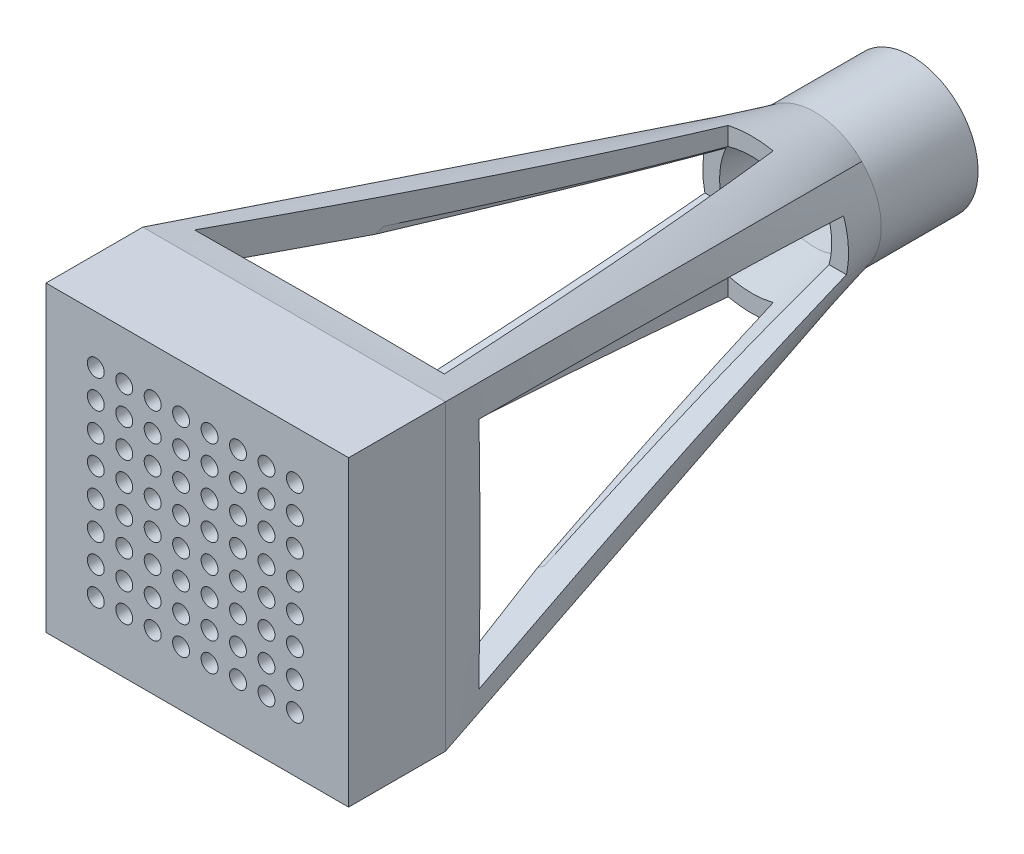
from build123d import *

# Parameters (mm, degrees)
SKETCH4_W           = 25
SKETCH4_H           = 25
BOSS_EXTRUDE1_DEPTH = 8
SKETCH5_R           = 0.7
CUT_EXTRUDE1_DEPTH  = 8
SKETCH6_R           = 5.5
SKETCH6_R_2         = 4.2
BOSS_EXTRUDE2_DEPTH = 8
CUT_EXTRUDE2_DEPTH  = 58
CUT_EXTRUDE3_DEPTH  = 58
CUT_EXTRUDE4_DEPTH  = 58
CUT_EXTRUDE5_DEPTH  = 58


with BuildPart() as part:
    # Loft1: read off the stored shape, not the designer's step
    # Loft1: loft between two sections, ruled curve by curve
    loft1_from = [
        Edge.make_bspline([(-12.5, 12.5, 43), (-10.416666667, 12.5, 43), (-8.333333333, 12.5, 43), (-5.208333333, 12.5, 43), (-4.166666667, 12.5, 43), (-2.083333333, 12.5, 43), (-1.041666667, 12.5, 43), (1.041666667, 12.5, 43), (2.083333333, 12.5, 43), (4.166666667, 12.5, 43), (5.208333333, 12.5, 43), (8.333333333, 12.5, 43), (10.416666667, 12.5, 43), (12.5, 12.5, 43)], [0, 0, 0, 0, 0.25, 0.25, 0.375, 0.375, 0.5, 0.5, 0.625, 0.625, 0.75, 0.75, 1, 1, 1, 1], 3),
        Edge.make_bspline([(12.5, 12.5, 43), (12.5, 10.416666667, 43), (12.5, 8.333333333, 43), (12.5, 5.208333333, 43), (12.5, 4.166666667, 43), (12.5, 2.083333333, 43), (12.5, 1.041666667, 43), (12.5, -1.041666667, 43), (12.5, -2.083333333, 43), (12.5, -4.166666667, 43), (12.5, -5.208333333, 43), (12.5, -8.333333333, 43), (12.5, -10.416666667, 43), (12.5, -12.5, 43)], [0, 0, 0, 0, 0.25, 0.25, 0.375, 0.375, 0.5, 0.5, 0.625, 0.625, 0.75, 0.75, 1, 1, 1, 1], 3),
        Edge.make_bspline([(-12.5, -12.5, 43), (-12.5, -10.416666667, 43), (-12.5, -8.333333333, 43), (-12.5, -5.208333333, 43), (-12.5, -4.166666667, 43), (-12.5, -2.083333333, 43), (-12.5, -1.041666667, 43), (-12.5, 1.041666667, 43), (-12.5, 2.083333333, 43), (-12.5, 4.166666667, 43), (-12.5, 5.208333333, 43), (-12.5, 8.333333333, 43), (-12.5, 10.416666667, 43), (-12.5, 12.5, 43)], [0, 0, 0, 0, 0.25, 0.25, 0.375, 0.375, 0.5, 0.5, 0.625, 0.625, 0.75, 0.75, 1, 1, 1, 1], 3),
        Edge.make_bspline([(12.5, -12.5, 43), (10.416666667, -12.5, 43), (8.333333333, -12.5, 43), (5.208333333, -12.5, 43), (4.166666667, -12.5, 43), (2.083333333, -12.5, 43), (1.041666667, -12.5, 43), (-1.041666667, -12.5, 43), (-2.083333333, -12.5, 43), (-4.166666667, -12.5, 43), (-5.208333333, -12.5, 43), (-8.333333333, -12.5, 43), (-10.416666667, -12.5, 43), (-12.5, -12.5, 43)], [0, 0, 0, 0, 0.25, 0.25, 0.375, 0.375, 0.5, 0.5, 0.625, 0.625, 0.75, 0.75, 1, 1, 1, 1], 3),
    ]
    loft1_to = [
        Edge.make_bspline([(-3.889087297, 3.889087297, 0), (-3.430753963, 4.34742063, 0), (-2.852736933, 4.758372279, 0), (-1.85034465, 5.192184354, 0), (-1.494698167, 5.306317307, 0), (-0.759306052, 5.460272914, 0), (-0.379695766, 5.5, 0), (0.379695766, 5.5, 0), (0.759306052, 5.460272914, 0), (1.494698167, 5.306317307, 0), (1.85034465, 5.192184354, 0), (2.852736933, 4.758372279, 0), (3.430753963, 4.34742063, 0), (3.889087297, 3.889087297, 0)], [0, 0, 0, 0, 0.25, 0.25, 0.375, 0.375, 0.5, 0.5, 0.625, 0.625, 0.75, 0.75, 1, 1, 1, 1], 3),
        Edge.make_bspline([(3.889087297, 3.889087297, 0), (4.34742063, 3.430753963, 0), (4.758372279, 2.852736933, 0), (5.192184354, 1.85034465, 0), (5.306317307, 1.494698167, 0), (5.460272914, 0.759306052, 0), (5.5, 0.379695766, 0), (5.5, -0.379695766, 0), (5.460272914, -0.759306052, 0), (5.306317307, -1.494698167, 0), (5.192184354, -1.85034465, 0), (4.758372279, -2.852736933, 0), (4.34742063, -3.430753963, 0), (3.889087297, -3.889087297, 0)], [0, 0, 0, 0, 0.25, 0.25, 0.375, 0.375, 0.5, 0.5, 0.625, 0.625, 0.75, 0.75, 1, 1, 1, 1], 3),
        Edge.make_bspline([(-3.889087297, -3.889087297, 0), (-4.34742063, -3.430753963, 0), (-4.758372279, -2.852736933, 0), (-5.192184354, -1.85034465, 0), (-5.306317307, -1.494698167, 0), (-5.460272914, -0.759306052, 0), (-5.5, -0.379695766, 0), (-5.5, 0.379695766, 0), (-5.460272914, 0.759306052, 0), (-5.306317307, 1.494698167, 0), (-5.192184354, 1.85034465, 0), (-4.758372279, 2.852736933, 0), (-4.34742063, 3.430753963, 0), (-3.889087297, 3.889087297, 0)], [0, 0, 0, 0, 0.25, 0.25, 0.375, 0.375, 0.5, 0.5, 0.625, 0.625, 0.75, 0.75, 1, 1, 1, 1], 3),
        Edge.make_bspline([(3.889087297, -3.889087297, 0), (3.430753963, -4.34742063, 0), (2.852736933, -4.758372279, 0), (1.85034465, -5.192184354, 0), (1.494698167, -5.306317307, 0), (0.759306052, -5.460272914, 0), (0.379695766, -5.5, 0), (-0.379695766, -5.5, 0), (-0.759306052, -5.460272914, 0), (-1.494698167, -5.306317307, 0), (-1.85034465, -5.192184354, 0), (-2.852736933, -4.758372279, 0), (-3.430753963, -4.34742063, 0), (-3.889087297, -3.889087297, 0)], [0, 0, 0, 0, 0.25, 0.25, 0.375, 0.375, 0.5, 0.5, 0.625, 0.625, 0.75, 0.75, 1, 1, 1, 1], 3),
    ]
    loft1 = Solid(Shell([*[Face.make_surface_from_curves(loft1_from[k], loft1_to[k]) for k in range(4)], Face(Wire(loft1_from)), Face(Wire(loft1_to))]))
    add(loft1)

    # Cut-Loft1: read off the stored shape, not the designer's step
    # Cut-Loft1: loft between two sections, ruled curve by curve
    cut_loft1_from = [
        Edge.make_bspline([(-2.969848481, -2.969848481, 0), (-2.619848481, -3.319848481, 0), (-2.178453658, -3.633666104, 0), (-1.157836061, -4.075365671, 0), (-0.579898987, -4.2, 0), (0.579898987, -4.2, 0), (1.157836061, -4.075365671, 0), (2.178453658, -3.633666104, 0), (2.619848481, -3.319848481, 0), (2.969848481, -2.969848481, 0)], [0, 0, 0, 0, 0.25, 0.25, 0.5, 0.5, 0.75, 0.75, 1, 1, 1, 1], 3),
        Edge.make_bspline([(2.969848481, -2.969848481, 0), (3.319848481, -2.619848481, 0), (3.633666104, -2.178453658, 0), (4.075365671, -1.157836061, 0), (4.2, -0.579898987, 0), (4.2, 0.579898987, 0), (4.075365671, 1.157836061, 0), (3.633666104, 2.178453658, 0), (3.319848481, 2.619848481, 0), (2.969848481, 2.969848481, 0)], [0, 0, 0, 0, 0.25, 0.25, 0.5, 0.5, 0.75, 0.75, 1, 1, 1, 1], 3),
        Edge.make_bspline([(-2.969848481, 2.969848481, 0), (-3.319848481, 2.619848481, 0), (-3.633666104, 2.178453658, 0), (-4.075365671, 1.157836061, 0), (-4.2, 0.579898987, 0), (-4.2, -0.579898987, 0), (-4.075365671, -1.157836061, 0), (-3.633666104, -2.178453658, 0), (-3.319848481, -2.619848481, 0), (-2.969848481, -2.969848481, 0)], [0, 0, 0, 0, 0.25, 0.25, 0.5, 0.5, 0.75, 0.75, 1, 1, 1, 1], 3),
        Edge.make_bspline([(2.969848481, 2.969848481, 0), (2.619848481, 3.319848481, 0), (2.178453658, 3.633666104, 0), (1.157836061, 4.075365671, 0), (0.579898987, 4.2, 0), (-0.579898987, 4.2, 0), (-1.157836061, 4.075365671, 0), (-2.178453658, 3.633666104, 0), (-2.619848481, 3.319848481, 0), (-2.969848481, 2.969848481, 0)], [0, 0, 0, 0, 0.25, 0.25, 0.5, 0.5, 0.75, 0.75, 1, 1, 1, 1], 3),
    ]
    cut_loft1_to = [
        Edge.make_bspline([(-10, -10, 43), (-8.333333333, -10, 43), (-6.666666667, -10, 43), (-3.333333333, -10, 43), (-1.666666667, -10, 43), (1.666666667, -10, 43), (3.333333333, -10, 43), (6.666666667, -10, 43), (8.333333333, -10, 43), (10, -10, 43)], [0, 0, 0, 0, 0.25, 0.25, 0.5, 0.5, 0.75, 0.75, 1, 1, 1, 1], 3),
        Edge.make_bspline([(10, -10, 43), (10, -8.333333333, 43), (10, -6.666666667, 43), (10, -3.333333333, 43), (10, -1.666666667, 43), (10, 1.666666667, 43), (10, 3.333333333, 43), (10, 6.666666667, 43), (10, 8.333333333, 43), (10, 10, 43)], [0, 0, 0, 0, 0.25, 0.25, 0.5, 0.5, 0.75, 0.75, 1, 1, 1, 1], 3),
        Edge.make_bspline([(-10, 10, 43), (-10, 8.333333333, 43), (-10, 6.666666667, 43), (-10, 3.333333333, 43), (-10, 1.666666667, 43), (-10, -1.666666667, 43), (-10, -3.333333333, 43), (-10, -6.666666667, 43), (-10, -8.333333333, 43), (-10, -10, 43)], [0, 0, 0, 0, 0.25, 0.25, 0.5, 0.5, 0.75, 0.75, 1, 1, 1, 1], 3),
        Edge.make_bspline([(10, 10, 43), (8.333333333, 10, 43), (6.666666667, 10, 43), (3.333333333, 10, 43), (1.666666667, 10, 43), (-1.666666667, 10, 43), (-3.333333333, 10, 43), (-6.666666667, 10, 43), (-8.333333333, 10, 43), (-10, 10, 43)], [0, 0, 0, 0, 0.25, 0.25, 0.5, 0.5, 0.75, 0.75, 1, 1, 1, 1], 3),
    ]
    cut_loft1 = Solid(Shell([*[Face.make_surface_from_curves(cut_loft1_from[k], cut_loft1_to[k]) for k in range(4)], Face(Wire(cut_loft1_from)), Face(Wire(cut_loft1_to))]))
    add(cut_loft1, mode=Mode.SUBTRACT)

    # Sketch4 → Boss-Extrude1 (add)
    with BuildSketch(Plane.XY.offset(43)):
        Rectangle(SKETCH4_W, SKETCH4_H)
    extrude(amount=BOSS_EXTRUDE1_DEPTH)

    # Sketch5 → Cut-Extrude1 (cut)
    with BuildSketch(Plane.XY.offset(43)):
        with Locations((-8.388056057, 8.509622087)):
            Circle(SKETCH5_R)
        with Locations((-6.038056057, 8.509622087)):
            Circle(SKETCH5_R)
        with Locations((-3.688056057, 8.509622087)):
            Circle(SKETCH5_R)
        with Locations((-1.338056057, 8.509622087)):
            Circle(SKETCH5_R)
        with Locations((1.011943943, 8.509622087)):
            Circle(SKETCH5_R)
        with Locations((3.361943943, 8.509622087)):
            Circle(SKETCH5_R)
        with Locations((5.711943943, 8.509622087)):
            Circle(SKETCH5_R)
        with Locations((8.061943943, 8.509622087)):
            Circle(SKETCH5_R)
        with Locations((-6.038056057, 6.159622087)):
            Circle(SKETCH5_R)
        with Locations((-3.688056057, 6.159622087)):
            Circle(SKETCH5_R)
        with Locations((-1.338056057, 6.159622087)):
            Circle(SKETCH5_R)
        with Locations((1.011943943, 6.159622087)):
            Circle(SKETCH5_R)
        with Locations((3.361943943, 6.159622087)):
            Circle(SKETCH5_R)
        with Locations((5.711943943, 6.159622087)):
            Circle(SKETCH5_R)
        with Locations((8.061943943, 6.159622087)):
            Circle(SKETCH5_R)
        with Locations((-6.038056057, 3.809622087)):
            Circle(SKETCH5_R)
        with Locations((-3.688056057, 3.809622087)):
            Circle(SKETCH5_R)
        with Locations((-1.338056057, 3.809622087)):
            Circle(SKETCH5_R)
        with Locations((1.011943943, 3.809622087)):
            Circle(SKETCH5_R)
        with Locations((3.361943943, 3.809622087)):
            Circle(SKETCH5_R)
        with Locations((5.711943943, 3.809622087)):
            Circle(SKETCH5_R)
        with Locations((8.061943943, 3.809622087)):
            Circle(SKETCH5_R)
        with Locations((-6.038056057, 1.459622087)):
            Circle(SKETCH5_R)
        with Locations((-3.688056057, 1.459622087)):
            Circle(SKETCH5_R)
        with Locations((-1.338056057, 1.459622087)):
            Circle(SKETCH5_R)
        with Locations((1.011943943, 1.459622087)):
            Circle(SKETCH5_R)
        with Locations((3.361943943, 1.459622087)):
            Circle(SKETCH5_R)
        with Locations((5.711943943, 1.459622087)):
            Circle(SKETCH5_R)
        with Locations((8.061943943, 1.459622087)):
            Circle(SKETCH5_R)
        with Locations((-6.038056057, -0.890377913)):
            Circle(SKETCH5_R)
        with Locations((-3.688056057, -0.890377913)):
            Circle(SKETCH5_R)
        with Locations((-1.338056057, -0.890377913)):
            Circle(SKETCH5_R)
        with Locations((1.011943943, -0.890377913)):
            Circle(SKETCH5_R)
        with Locations((3.361943943, -0.890377913)):
            Circle(SKETCH5_R)
        with Locations((5.711943943, -0.890377913)):
            Circle(SKETCH5_R)
        with Locations((8.061943943, -0.890377913)):
            Circle(SKETCH5_R)
        with Locations((-6.038056057, -3.240377913)):
            Circle(SKETCH5_R)
        with Locations((-3.688056057, -3.240377913)):
            Circle(SKETCH5_R)
        with Locations((-1.338056057, -3.240377913)):
            Circle(SKETCH5_R)
        with Locations((1.011943943, -3.240377913)):
            Circle(SKETCH5_R)
        with Locations((3.361943943, -3.240377913)):
            Circle(SKETCH5_R)
        with Locations((5.711943943, -3.240377913)):
            Circle(SKETCH5_R)
        with Locations((8.061943943, -3.240377913)):
            Circle(SKETCH5_R)
        with Locations((-6.038056057, -5.590377913)):
            Circle(SKETCH5_R)
        with Locations((-3.688056057, -5.590377913)):
            Circle(SKETCH5_R)
        with Locations((-1.338056057, -5.590377913)):
            Circle(SKETCH5_R)
        with Locations((1.011943943, -5.590377913)):
            Circle(SKETCH5_R)
        with Locations((3.361943943, -5.590377913)):
            Circle(SKETCH5_R)
        with Locations((5.711943943, -5.590377913)):
            Circle(SKETCH5_R)
        with Locations((8.061943943, -5.590377913)):
            Circle(SKETCH5_R)
        with Locations((-6.038056057, -7.940377913)):
            Circle(SKETCH5_R)
        with Locations((-3.688056057, -7.940377913)):
            Circle(SKETCH5_R)
        with Locations((-1.338056057, -7.940377913)):
            Circle(SKETCH5_R)
        with Locations((1.011943943, -7.940377913)):
            Circle(SKETCH5_R)
        with Locations((3.361943943, -7.940377913)):
            Circle(SKETCH5_R)
        with Locations((5.711943943, -7.940377913)):
            Circle(SKETCH5_R)
        with Locations((8.061943943, -7.940377913)):
            Circle(SKETCH5_R)
        with Locations((-8.388056057, 6.159622087)):
            Circle(SKETCH5_R)
        with Locations((-8.388056057, 3.809622087)):
            Circle(SKETCH5_R)
        with Locations((-8.388056057, 1.459622087)):
            Circle(SKETCH5_R)
        with Locations((-8.388056057, -0.890377913)):
            Circle(SKETCH5_R)
        with Locations((-8.388056057, -3.240377913)):
            Circle(SKETCH5_R)
        with Locations((-8.388056057, -5.590377913)):
            Circle(SKETCH5_R)
        with Locations((-8.388056057, -7.940377913)):
            Circle(SKETCH5_R)
    extrude(amount=CUT_EXTRUDE1_DEPTH, mode=Mode.SUBTRACT)

    # Sketch6 → Boss-Extrude2 (add)
    with BuildSketch(Plane(origin=(0, 0, 0), x_dir=(-1, 0, 0), z_dir=(0, 0, -1))):
        with Locations(Location((0, 0, 0), (0, 0, 135))):
            Circle(SKETCH6_R)
        with Locations(Location((0, 0, 0), (0, 0, 225))):
            Circle(SKETCH6_R_2, mode=Mode.SUBTRACT)
    extrude(amount=BOSS_EXTRUDE2_DEPTH)

    # Sketch7 → Cut-Extrude2 (cut)
    with BuildSketch(Plane(origin=(0, 0, 0), x_dir=(1, 0, 0), z_dir=(0, 1, 0))):
        Polygon((-1.965717978, -5.179711055), (1.757861177, -5.179711055), (10.010117682, -40.604031661), (-10.620523581, -40.604031661), align=None)
    extrude(amount=-CUT_EXTRUDE2_DEPTH, mode=Mode.SUBTRACT)

    # Sketch7<3> → Cut-Extrude3 (cut)
    with BuildSketch(Plane(origin=(0, 0, 0), x_dir=(1, 0, 0), z_dir=(0, 1, 0))):
        Polygon((-1.965717978, -5.179711055), (1.757861177, -5.179711055), (10.010117682, -40.604031661), (-10.620523581, -40.604031661), align=None)
    extrude(amount=CUT_EXTRUDE3_DEPTH, mode=Mode.SUBTRACT)

    # Sketch8 → Cut-Extrude4 (cut)
    with BuildSketch(Plane(origin=(0, 0, 0), x_dir=(0, 0, -1), z_dir=(1, 0, 0))):
        Polygon((-3.220235662, 2.475386447), (-3.220235662, -1.618521908), (-39.589374996, -10.091960129), (-39.589374996, 9.23509559), align=None)
    extrude(amount=-CUT_EXTRUDE4_DEPTH, mode=Mode.SUBTRACT)

    # Sketch8<3> → Cut-Extrude5 (cut)
    with BuildSketch(Plane(origin=(0, 0, 0), x_dir=(0, 0, -1), z_dir=(1, 0, 0))):
        Polygon((-3.220235662, 2.475386447), (-3.220235662, -1.618521908), (-39.589374996, -10.091960129), (-39.589374996, 9.23509559), align=None)
    extrude(amount=CUT_EXTRUDE5_DEPTH, mode=Mode.SUBTRACT)


solid = part.part
